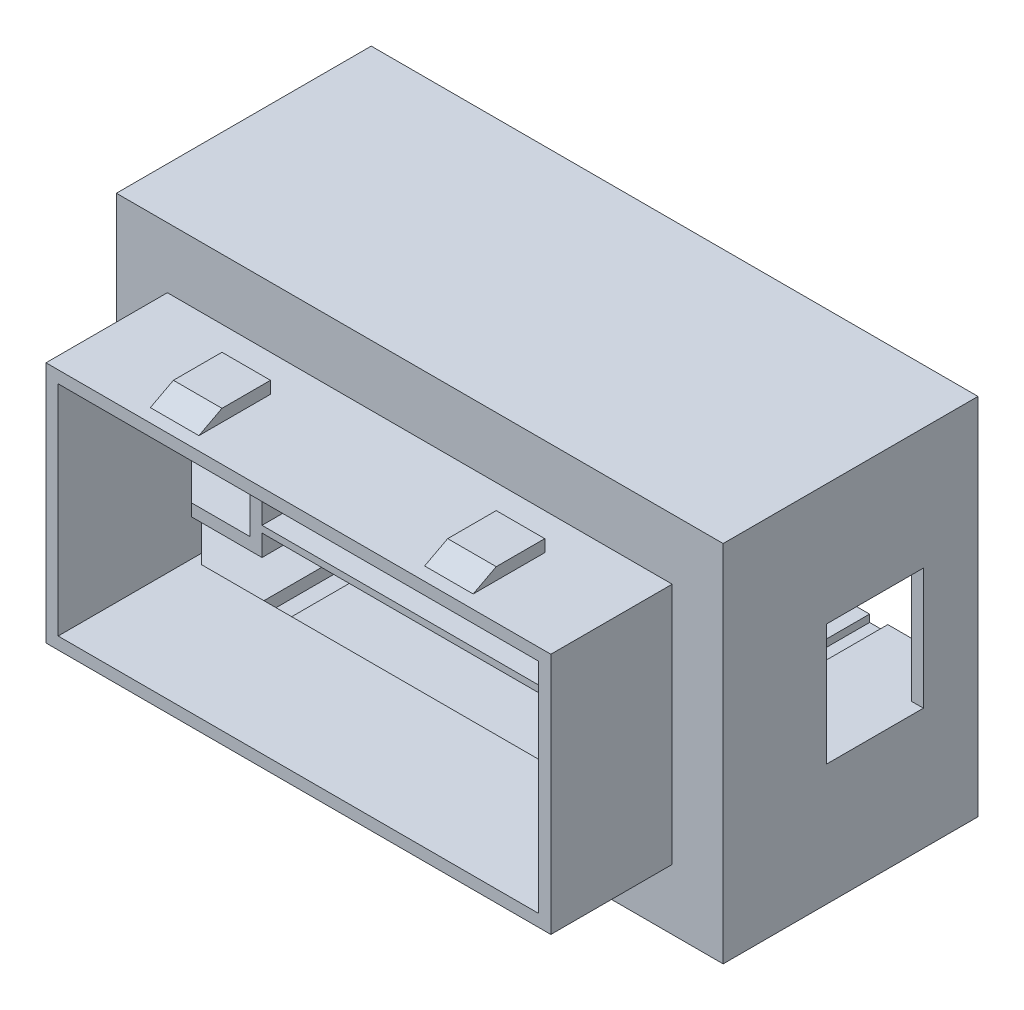
from build123d import *

# Parameters (mm, degrees)
SKETCH1_W            = 41.6
SKETCH1_H            = 20
SKETCH1_W_2          = 39.6
SKETCH1_H_2          = 18
BOSS_EXTRUDE2_DEPTH  = 10
SKETCH2_W            = 4
SKETCH2_H            = 10
BOSS_EXTRUDE3_DEPTH  = 1
SKETCH3_W            = 3
SKETCH3_H            = 1
CUT_EXTRUDE1_DEPTH   = 27
SKETCH4_W            = 4
SKETCH4_H            = 10
BOSS_EXTRUDE4_DEPTH  = 1
SKETCH5_W            = 3
SKETCH5_H            = 1
CUT_EXTRUDE2_DEPTH   = 27
SKETCH6_W            = 50
SKETCH6_H            = 30
SKETCH6_W_2          = 41.6
SKETCH6_H_2          = 20
SKETCH6_W_3          = 39.6
SKETCH6_H_3          = 18
BOSS_EXTRUDE6_DEPTH  = 1
SKETCH7_W            = 50
SKETCH7_H            = 30
SKETCH7_W_2          = 48
SKETCH7_H_2          = 28
BOSS_EXTRUDE7_DEPTH  = 20
SKETCH8_W            = 4.2
SKETCH8_H            = 1
BOSS_EXTRUDE8_DEPTH  = 20
SKETCH9_W            = 4.2
SKETCH9_H            = 1
BOSS_EXTRUDE9_DEPTH  = 20
SKETCH10_W           = 4
SKETCH10_H           = 4
BOSS_EXTRUDE10_DEPTH = 20
SKETCH11_W           = 2
SKETCH11_H           = 10
CUT_EXTRUDE3_DEPTH   = 1
SKETCH12_W           = 2
SKETCH12_H           = 10
CUT_EXTRUDE4_DEPTH   = 1
SKETCH13_R           = 1.5
CUT_EXTRUDE5_DEPTH   = 10
CHAMFER2_SIZE        = 5
CHAMFER3_SIZE        = 5
CHAMFER4_SIZE        = 4
SKETCH16_W           = 1.2
SKETCH16_H           = 1
BOSS_EXTRUDE11_DEPTH = 20
BOSS_EXTRUDE12_DEPTH = 20
SKETCH18_W           = 28
SKETCH18_H           = 0.549749779
BOSS_EXTRUDE13_DEPTH = 20
SKETCH19_W           = 1.2
SKETCH19_H           = 1
CUT_EXTRUDE6_DEPTH   = 20
SKETCH20_W           = 1.5
SKETCH20_H           = 1
BOSS_EXTRUDE14_DEPTH = 20
SKETCH22_W           = 0.3
SKETCH22_H           = 1
BOSS_EXTRUDE16_DEPTH = 20
SKETCH24_W           = 1.2
SKETCH24_H           = 1
CUT_EXTRUDE7_DEPTH   = 20
SKETCH25_W           = 1.5
SKETCH25_H           = 1
BOSS_EXTRUDE17_DEPTH = 20
SKETCH26_W           = 1.5
SKETCH26_H           = 0.6
CUT_EXTRUDE8_DEPTH   = 20
SKETCH27_W           = 1.5
SKETCH27_H           = 0.6
CUT_EXTRUDE9_DEPTH   = 20


# Some blends are built 0.0001 mm under size
with BuildPart() as part:
    # Sketch1 → Boss-Extrude2 (new body)
    with BuildSketch(Plane.XY):
        Rectangle(SKETCH1_W, SKETCH1_H)
        Rectangle(SKETCH1_W_2, SKETCH1_H_2, mode=Mode.SUBTRACT)
    extrude(amount=BOSS_EXTRUDE2_DEPTH)

    # Sketch2 → Boss-Extrude3 (add)
    with BuildSketch(Plane.XZ.offset(10)):
        with Locations((-11.3, 5)):
            Rectangle(SKETCH2_W, SKETCH2_H)
        with Locations((11.3, 5)):
            Rectangle(SKETCH2_W, SKETCH2_H)
    extrude(amount=BOSS_EXTRUDE3_DEPTH)

    # Sketch3 → Cut-Extrude1 (cut)
    with BuildSketch(Plane.ZY.offset(13.3)):
        Polygon((8.900149248, -10), (7, -11), (10, -11), (10, -10), align=None)
        with Locations((1.5, -10.5)):
            Rectangle(SKETCH3_W, SKETCH3_H)
    extrude(amount=-CUT_EXTRUDE1_DEPTH, mode=Mode.SUBTRACT)

    # Sketch4 → Boss-Extrude4 (add)
    with BuildSketch(Plane(origin=(0, 10, 0), x_dir=(1, 0, 0), z_dir=(0, 1, 0))):
        with Locations((11.3, -5)):
            Rectangle(SKETCH4_W, SKETCH4_H)
        with Locations((-11.3, -5)):
            Rectangle(SKETCH4_W, SKETCH4_H)
    extrude(amount=BOSS_EXTRUDE4_DEPTH)

    # Sketch5 → Cut-Extrude2 (cut)
    with BuildSketch(Plane(origin=(13.3, 0, 0), x_dir=(0, 0, -1), z_dir=(1, 0, 0))):
        Polygon((-7, 11), (-10, 11), (-10, 10), (-8.900149248, 10), align=None)
        with Locations((-1.5, 10.5)):
            Rectangle(SKETCH5_W, SKETCH5_H)
    extrude(amount=-CUT_EXTRUDE2_DEPTH, mode=Mode.SUBTRACT)

    # Sketch6 → Boss-Extrude6 (add)
    # profile 1 of 2: a face of its own
    with BuildSketch(Plane(origin=(0, 0, 0), x_dir=(-1, 0, 0), z_dir=(0, 0, -1))):
        Rectangle(SKETCH6_W, SKETCH6_H)
        Rectangle(SKETCH6_W_2, SKETCH6_H_2, mode=Mode.SUBTRACT)
    # profile 2 of 2: a face of its own
    with BuildSketch(Plane(origin=(0, 0, 0), x_dir=(-1, 0, 0), z_dir=(0, 0, -1))):
        Rectangle(SKETCH6_W_2, SKETCH6_H_2)
        Rectangle(SKETCH6_W_3, SKETCH6_H_3, mode=Mode.SUBTRACT)
    extrude(amount=BOSS_EXTRUDE6_DEPTH)

    # Sketch7 → Boss-Extrude7 (add)
    with BuildSketch(Plane(origin=(0, 0, -1), x_dir=(-1, 0, 0), z_dir=(0, 0, -1))):
        Rectangle(SKETCH7_W, SKETCH7_H)
        Rectangle(SKETCH7_W_2, SKETCH7_H_2, mode=Mode.SUBTRACT)
    extrude(amount=BOSS_EXTRUDE7_DEPTH)

    # Sketch8 → Boss-Extrude8 (add)
    with BuildSketch(Plane(origin=(0, 0, -1), x_dir=(-1, 0, 0), z_dir=(0, 0, -1))):
        Polygon((-15, -5), (-19.8, -5), (-19.8, -6), (-14, -6), (-14, 6), (-19.8, 6), (-19.8, 5), (-15, 5), align=None)
        with Locations((-21.9, 5.5)):
            Rectangle(SKETCH8_W, SKETCH8_H)
        with Locations((-21.9, -5.5)):
            Rectangle(SKETCH8_W, SKETCH8_H)
    extrude(amount=BOSS_EXTRUDE8_DEPTH)

    # Sketch9 → Boss-Extrude9 (add)
    with BuildSketch(Plane(origin=(0, 0, -1), x_dir=(-1, 0, 0), z_dir=(0, 0, -1))):
        Polygon((15, 5), (19.8, 5), (19.8, 6), (14, 6), (14, -6), (19.8, -6), (19.8, -5), (15, -5), align=None)
        with Locations((21.9, 5.5)):
            Rectangle(SKETCH9_W, SKETCH9_H)
        with Locations((21.9, -5.5)):
            Rectangle(SKETCH9_W, SKETCH9_H)
    extrude(amount=BOSS_EXTRUDE9_DEPTH)

    # Sketch10 → Boss-Extrude10 (add)
    with BuildSketch(Plane(origin=(0, 0, -1), x_dir=(-1, 0, 0), z_dir=(0, 0, -1))):
        with Locations((-22, 12)):
            Rectangle(SKETCH10_W, SKETCH10_H)
        with Locations((22, 12)):
            Rectangle(SKETCH10_W, SKETCH10_H)
        with Locations((22, -12)):
            Rectangle(SKETCH10_W, SKETCH10_H)
        with Locations((-22, -12)):
            Rectangle(SKETCH10_W, SKETCH10_H)
    extrude(amount=BOSS_EXTRUDE10_DEPTH)

    # Sketch11 → Cut-Extrude3 (cut)
    with BuildSketch(Plane.ZY.offset(25)):
        Polygon((-10.5, -5), (-10.5, 5), (-16.5, 5), (-16.5, 0), (-16.5, -5), align=None)
        with Locations((-9.5, 0)):
            Rectangle(SKETCH11_W, SKETCH11_H)
    extrude(amount=-CUT_EXTRUDE3_DEPTH, mode=Mode.SUBTRACT)

    # Sketch12 → Cut-Extrude4 (cut)
    with BuildSketch(Plane(origin=(25, 0, 0), x_dir=(0, 0, -1), z_dir=(1, 0, 0))):
        with Locations((9.5, 0)):
            Rectangle(SKETCH12_W, SKETCH12_H)
        Polygon((16.5, 5), (10.5, 5), (10.5, -5), (16.5, -5), (16.5, 0), align=None)
    extrude(amount=-CUT_EXTRUDE4_DEPTH, mode=Mode.SUBTRACT)

    # Sketch13 → Cut-Extrude5 (cut)
    with BuildSketch(Plane(origin=(0, 0, -21), x_dir=(-1, 0, 0), z_dir=(0, 0, -1))):
        with Locations((-22.5, 12.5)):
            Circle(SKETCH13_R)
        with Locations((22.5, 12.5)):
            Circle(SKETCH13_R)
        with Locations((22.5, -12.5)):
            Circle(SKETCH13_R)
        with Locations((-22.5, -12.5)):
            Circle(SKETCH13_R)
    extrude(amount=-CUT_EXTRUDE5_DEPTH, mode=Mode.SUBTRACT)

    # Chamfer2
    chamfer2_edges = [part.edges().sort_by_distance(p)[0] for p in [
        (0, 14, -1),
        (0, -14, -1),
    ]]
    chamfer(chamfer2_edges, length=CHAMFER2_SIZE - 0.0001)  # a hair under: the kernel refuses the full size

    # Chamfer3
    # the kernel refuses this chamfer: 5 mm, written as the material it adds along each edge
    with BuildSketch(Plane(origin=(24, -21.85851494, -1), x_dir=(-0.9996219169112968, 0, 0.02749587661058636), z_dir=(0, 1, 0))) as chamfer3_piece_1_section:
        Polygon((CHAMFER3_SIZE * 0.999621916911, -CHAMFER3_SIZE * 0.0274958766106), (-CHAMFER3_SIZE * 0.0274958766106, -CHAMFER3_SIZE * 0.999621916911), (0, 0), align=None)
    chamfer3_piece_1 = extrude(amount=28.71692988, mode=Mode.PRIVATE)
    chamfer3_piece_1 = split(chamfer3_piece_1, bisect_by=Plane(origin=(19.8, -10.000025, -1.99995), z_dir=(1, 0, 0)), keep=Keep.TOP, mode=Mode.PRIVATE)
    chamfer3_piece_1 = split(chamfer3_piece_1, bisect_by=Plane(origin=(19.999975, -5, -1.99995), z_dir=(0, -1, 0)), keep=Keep.TOP, mode=Mode.PRIVATE)
    chamfer3_piece_1 = split(chamfer3_piece_1, bisect_by=Plane(origin=(19.999975, -10.0000375, -1.9999375), z_dir=(0, 0.7071067811865476, -0.7071067811865476)), keep=Keep.TOP, mode=Mode.PRIVATE)
    add(chamfer3_piece_1)
    with BuildSketch(Plane(origin=(24, -21.85851494, -1), x_dir=(-0.9996219169112968, 0, 0.02749587661058636), z_dir=(0, 1, 0))) as chamfer3_piece_2_section:
        Polygon((CHAMFER3_SIZE * 0.999621916911, -CHAMFER3_SIZE * 0.0274958766106), (-CHAMFER3_SIZE * 0.0274958766106, -CHAMFER3_SIZE * 0.999621916911), (0, 0), align=None)
    chamfer3_piece_2 = extrude(amount=28.71692988, mode=Mode.PRIVATE)
    chamfer3_piece_2 = split(chamfer3_piece_2, bisect_by=Plane(origin=(19.599975009, -9, -1.399950019), z_dir=(0, -1, 0)), keep=Keep.TOP, mode=Mode.PRIVATE)
    chamfer3_piece_2 = split(chamfer3_piece_2, bisect_by=Plane(origin=(19.599975009, -9.300037514, -1.299937514), z_dir=(0, 0.7071067811865476, -0.7071067811865476)), keep=Keep.TOP, mode=Mode.PRIVATE)
    add(chamfer3_piece_2)
    with BuildSketch(Plane(origin=(24, -21.85851494, -1), x_dir=(-0.9996219169112968, 0, 0.02749587661058636), z_dir=(0, 1, 0))) as chamfer3_piece_3_section:
        Polygon((CHAMFER3_SIZE * 0.999621916911, -CHAMFER3_SIZE * 0.0274958766106), (-CHAMFER3_SIZE * 0.0274958766106, -CHAMFER3_SIZE * 0.999621916911), (0, 0), align=None)
    chamfer3_piece_3 = extrude(amount=28.71692988, mode=Mode.PRIVATE)
    chamfer3_piece_3 = split(chamfer3_piece_3, bisect_by=Plane(origin=(19.8, 6.42920747, -1.451851852), z_dir=(1, 0, 0)), keep=Keep.TOP, mode=Mode.PRIVATE)
    chamfer3_piece_3 = split(chamfer3_piece_3, bisect_by=Plane(origin=(19.903703704, 5, -1.451851852), z_dir=(0, 1, 0)), keep=Keep.TOP, mode=Mode.PRIVATE)
    add(chamfer3_piece_3)
    with BuildSketch(Plane(origin=(-24, 21.85851494, -1), x_dir=(0.9996219169112968, 0, 0.02749587661058636), z_dir=(0, -1, 0))) as chamfer3_piece_4_section:
        Polygon((CHAMFER3_SIZE * 0.999621916911, -CHAMFER3_SIZE * 0.0274958766106), (-CHAMFER3_SIZE * 0.0274958766106, -CHAMFER3_SIZE * 0.999621916911), (0, 0), align=None)
    chamfer3_piece_4 = extrude(amount=28.71692988, mode=Mode.PRIVATE)
    chamfer3_piece_4 = split(chamfer3_piece_4, bisect_by=Plane(origin=(-19.8, 10.000025, -1.99995), z_dir=(-1, 0, 0)), keep=Keep.TOP, mode=Mode.PRIVATE)
    chamfer3_piece_4 = split(chamfer3_piece_4, bisect_by=Plane(origin=(-19.999975, 15, -1.99995), z_dir=(0, -1, 0)), keep=Keep.TOP, mode=Mode.PRIVATE)
    chamfer3_piece_4 = split(chamfer3_piece_4, bisect_by=Plane(origin=(-19.999975, 5, -1.99995), z_dir=(0, 1, 0)), keep=Keep.TOP, mode=Mode.PRIVATE)
    add(chamfer3_piece_4)
    with BuildSketch(Plane(origin=(-24, 21.85851494, -1), x_dir=(0.9996219169112968, 0, 0.02749587661058636), z_dir=(0, -1, 0))) as chamfer3_piece_5_section:
        Polygon((CHAMFER3_SIZE * 0.999621916911, -CHAMFER3_SIZE * 0.0274958766106), (-CHAMFER3_SIZE * 0.0274958766106, -CHAMFER3_SIZE * 0.999621916911), (0, 0), align=None)
    chamfer3_piece_5 = extrude(amount=28.71692988, mode=Mode.PRIVATE)
    chamfer3_piece_5 = split(chamfer3_piece_5, bisect_by=Plane(origin=(-19.599975009, 9, -1.399950019), z_dir=(0, 1, 0)), keep=Keep.TOP, mode=Mode.PRIVATE)
    chamfer3_piece_5 = split(chamfer3_piece_5, bisect_by=Plane(origin=(-19.599975009, 15, -1.399950019), z_dir=(0, -1, 0)), keep=Keep.TOP, mode=Mode.PRIVATE)
    add(chamfer3_piece_5)
    with BuildSketch(Plane(origin=(-24, 21.85851494, -1), x_dir=(0.9996219169112968, 0, 0.02749587661058636), z_dir=(0, -1, 0))) as chamfer3_piece_6_section:
        Polygon((CHAMFER3_SIZE * 0.999621916911, -CHAMFER3_SIZE * 0.0274958766106), (-CHAMFER3_SIZE * 0.0274958766106, -CHAMFER3_SIZE * 0.999621916911), (0, 0), align=None)
    chamfer3_piece_6 = extrude(amount=28.71692988, mode=Mode.PRIVATE)
    chamfer3_piece_6 = split(chamfer3_piece_6, bisect_by=Plane(origin=(-19.8, -6.42920747, -1.451851852), z_dir=(-1, 0, 0)), keep=Keep.TOP, mode=Mode.PRIVATE)
    chamfer3_piece_6 = split(chamfer3_piece_6, bisect_by=Plane(origin=(-19.903703704, -6, -1.451851852), z_dir=(0, -1, 0)), keep=Keep.TOP, mode=Mode.PRIVATE)
    add(chamfer3_piece_6)
    with BuildSketch(Plane(origin=(-24, 6.85841494, -1), x_dir=(0.9996219169112968, 0, 0.02749587661058636), z_dir=(0, -1, 0))) as chamfer3_piece_7_section:
        Polygon((CHAMFER3_SIZE * 0.999621916911, -CHAMFER3_SIZE * 0.0274958766106), (-CHAMFER3_SIZE * 0.0274958766106, -CHAMFER3_SIZE * 0.999621916911), (0, 0), align=None)
    chamfer3_piece_7 = extrude(amount=28.71692988, mode=Mode.PRIVATE)
    chamfer3_piece_7 = split(chamfer3_piece_7, bisect_by=Plane(origin=(-19.8, 6.42920747, -1.451851852), z_dir=(-1, 0, 0)), keep=Keep.TOP, mode=Mode.PRIVATE)
    chamfer3_piece_7 = split(chamfer3_piece_7, bisect_by=Plane(origin=(-19.903703704, 5, -1.451851852), z_dir=(0, 1, 0)), keep=Keep.TOP, mode=Mode.PRIVATE)
    add(chamfer3_piece_7)
    with BuildSketch(Plane(origin=(-24, -6, -1), x_dir=(0.9996219169112968, 0, 0.02749587661058636), z_dir=(0, -1, 0))) as chamfer3_piece_8_section:
        Polygon((CHAMFER3_SIZE * 0.999621916911, -CHAMFER3_SIZE * 0.0274958766106), (-CHAMFER3_SIZE * 0.0274958766106, -CHAMFER3_SIZE * 0.999621916911), (0, 0), align=None)
    chamfer3_piece_8 = extrude(amount=15.85851494, mode=Mode.PRIVATE)
    chamfer3_piece_8 = split(chamfer3_piece_8, bisect_by=Plane(origin=(-19.8, -7.5, -1.451851852), z_dir=(-1, 0, 0)), keep=Keep.TOP, mode=Mode.PRIVATE)
    chamfer3_piece_8 = split(chamfer3_piece_8, bisect_by=Plane(origin=(-19.903703704, -8.475975926, -0.475875926), z_dir=(0, 0.7071067811865476, -0.7071067811865476)), keep=Keep.TOP, mode=Mode.PRIVATE)
    add(chamfer3_piece_8)
    with BuildSketch(Plane(origin=(-24, 6.85841494, -1), x_dir=(0.9996219169112968, 0, 0.02749587661058636), z_dir=(0, -1, 0))) as chamfer3_piece_9_section:
        Polygon((CHAMFER3_SIZE * 0.999621916911, -CHAMFER3_SIZE * 0.0274958766106), (-CHAMFER3_SIZE * 0.0274958766106, -CHAMFER3_SIZE * 0.999621916911), (0, 0), align=None)
    chamfer3_piece_9 = extrude(amount=28.71692988, mode=Mode.PRIVATE)
    chamfer3_piece_9 = split(chamfer3_piece_9, bisect_by=Plane(origin=(-19.599975009, -9, -1.399950019), z_dir=(0, -1, 0)), keep=Keep.TOP, mode=Mode.PRIVATE)
    chamfer3_piece_9 = split(chamfer3_piece_9, bisect_by=Plane(origin=(-19.599975009, -9.300037514, -1.299937514), z_dir=(0, 0.7071067811865476, -0.7071067811865476)), keep=Keep.TOP, mode=Mode.PRIVATE)
    add(chamfer3_piece_9)
    with BuildSketch(Plane(origin=(24, -6.85841494, -1), x_dir=(-0.9996219169112968, 0, 0.02749587661058636), z_dir=(0, 1, 0))) as chamfer3_piece_10_section:
        Polygon((CHAMFER3_SIZE * 0.999621916911, -CHAMFER3_SIZE * 0.0274958766106), (-CHAMFER3_SIZE * 0.0274958766106, -CHAMFER3_SIZE * 0.999621916911), (0, 0), align=None)
    chamfer3_piece_10 = extrude(amount=28.71692988, mode=Mode.PRIVATE)
    chamfer3_piece_10 = split(chamfer3_piece_10, bisect_by=Plane(origin=(19.8, -6.42920747, -1.451851852), z_dir=(1, 0, 0)), keep=Keep.TOP, mode=Mode.PRIVATE)
    chamfer3_piece_10 = split(chamfer3_piece_10, bisect_by=Plane(origin=(19.903703704, -5, -1.451851852), z_dir=(0, -1, 0)), keep=Keep.TOP, mode=Mode.PRIVATE)
    add(chamfer3_piece_10)
    with BuildSketch(Plane(origin=(24, -6.85841494, -1), x_dir=(-0.9996219169112968, 0, 0.02749587661058636), z_dir=(0, 1, 0))) as chamfer3_piece_11_section:
        Polygon((CHAMFER3_SIZE * 0.999621916911, -CHAMFER3_SIZE * 0.0274958766106), (-CHAMFER3_SIZE * 0.0274958766106, -CHAMFER3_SIZE * 0.999621916911), (0, 0), align=None)
    chamfer3_piece_11 = extrude(amount=28.71692988, mode=Mode.PRIVATE)
    chamfer3_piece_11 = split(chamfer3_piece_11, bisect_by=Plane(origin=(19.8, 7.5, -1.451851852), z_dir=(1, 0, 0)), keep=Keep.TOP, mode=Mode.PRIVATE)
    chamfer3_piece_11 = split(chamfer3_piece_11, bisect_by=Plane(origin=(19.903703704, 15, -1.451851852), z_dir=(0, -1, 0)), keep=Keep.TOP, mode=Mode.PRIVATE)
    chamfer3_piece_11 = split(chamfer3_piece_11, bisect_by=Plane(origin=(19.903703704, 5, -1.451851852), z_dir=(0, 1, 0)), keep=Keep.TOP, mode=Mode.PRIVATE)
    add(chamfer3_piece_11)
    with BuildSketch(Plane(origin=(24, -6.85841494, -1), x_dir=(-0.9996219169112968, 0, 0.02749587661058636), z_dir=(0, 1, 0))) as chamfer3_piece_12_section:
        Polygon((CHAMFER3_SIZE * 0.999621916911, -CHAMFER3_SIZE * 0.0274958766106), (-CHAMFER3_SIZE * 0.0274958766106, -CHAMFER3_SIZE * 0.999621916911), (0, 0), align=None)
    chamfer3_piece_12 = extrude(amount=28.71692988, mode=Mode.PRIVATE)
    chamfer3_piece_12 = split(chamfer3_piece_12, bisect_by=Plane(origin=(19.599975009, 9, -1.399950019), z_dir=(0, 1, 0)), keep=Keep.TOP, mode=Mode.PRIVATE)
    chamfer3_piece_12 = split(chamfer3_piece_12, bisect_by=Plane(origin=(19.599975009, 15, -1.399950019), z_dir=(0, -1, 0)), keep=Keep.TOP, mode=Mode.PRIVATE)
    add(chamfer3_piece_12)

    # Chamfer4
    chamfer4_edges = [part.edges().sort_by_distance(p)[0] for p in [
        (24, 0, -1),
        (-24, 0, -1),
    ]]
    chamfer(chamfer4_edges, length=CHAMFER4_SIZE)

    # Sketch16 → Boss-Extrude11 (add)
    with BuildSketch(Plane(origin=(0, 0, -21), x_dir=(-1, 0, 0), z_dir=(0, 0, -1))):
        with Locations((-13.4, 0.5)):
            Rectangle(SKETCH16_W, SKETCH16_H)
        with Locations((-13.4, -1.5)):
            Rectangle(SKETCH16_W, SKETCH16_H)
        with Locations((13.4, 0.5)):
            Rectangle(SKETCH16_W, SKETCH16_H)
        Polygon((13, -1), (12.8, -1), (12.8, -2), (14, -2), (14, -1), align=None)
    extrude(amount=-BOSS_EXTRUDE11_DEPTH)

    # Sketch17 → Boss-Extrude12 (add)
    with BuildSketch(Plane(origin=(0, 0, -21), x_dir=(-1, 0, 0), z_dir=(0, 0, -1))):
        Polygon((-20, -10), (-20, -10.5), (-16.744161901, -10.5), (12.056353702, -10.5), (12.056353702, -9.5), (-24, -9.5), (-24, -10), align=None)
        Polygon((14.342415664, -9.5), (14.342415664, -10.5), (20, -10.5), (20, -10), (24, -10), (24, -9.5), align=None)
    extrude(amount=-BOSS_EXTRUDE12_DEPTH)

    # Sketch18 → Boss-Extrude13 (add)
    with BuildSketch(Plane(origin=(0, 0, -21), x_dir=(-1, 0, 0), z_dir=(0, 0, -1))):
        with Locations((0, -3.97487489)):
            Rectangle(SKETCH18_W, SKETCH18_H)
    extrude(amount=-BOSS_EXTRUDE13_DEPTH)

    # Sketch19 → Cut-Extrude6 (cut)
    with BuildSketch(Plane(origin=(0, 0, -21), x_dir=(-1, 0, 0), z_dir=(0, 0, -1))):
        with Locations((-13.4, 0.5)):
            Rectangle(SKETCH19_W, SKETCH19_H)
    extrude(amount=-CUT_EXTRUDE6_DEPTH, mode=Mode.SUBTRACT)

    # Sketch20 → Boss-Extrude14 (add)
    with BuildSketch(Plane(origin=(0, 0, -21), x_dir=(-1, 0, 0), z_dir=(0, 0, -1))):
        with Locations((-13.25, 1.2)):
            Rectangle(SKETCH20_W, SKETCH20_H)
    extrude(amount=-BOSS_EXTRUDE14_DEPTH)

    # Sketch22 → Boss-Extrude16 (add)
    with BuildSketch(Plane(origin=(0, 0, -21), x_dir=(-1, 0, 0), z_dir=(0, 0, -1))):
        with Locations((-12.65, -1.5)):
            Rectangle(SKETCH22_W, SKETCH22_H)
    extrude(amount=-BOSS_EXTRUDE16_DEPTH)

    # Sketch24 → Cut-Extrude7 (cut)
    with BuildSketch(Plane(origin=(0, 0, -21), x_dir=(-1, 0, 0), z_dir=(0, 0, -1))):
        with Locations((13.4, 0.5)):
            Rectangle(SKETCH24_W, SKETCH24_H)
    extrude(amount=-CUT_EXTRUDE7_DEPTH, mode=Mode.SUBTRACT)

    # Sketch25 → Boss-Extrude17 (add)
    with BuildSketch(Plane(origin=(0, 0, -21), x_dir=(-1, 0, 0), z_dir=(0, 0, -1))):
        with Locations((13.25, 1.2)):
            Rectangle(SKETCH25_W, SKETCH25_H)
    extrude(amount=-BOSS_EXTRUDE17_DEPTH)

    # Sketch26 → Cut-Extrude8 (cut)
    with BuildSketch(Plane(origin=(0, 0, -21), x_dir=(-1, 0, 0), z_dir=(0, 0, -1))):
        with Locations((16.75, 5.3)):
            Rectangle(SKETCH26_W, SKETCH26_H)
    extrude(amount=-CUT_EXTRUDE8_DEPTH, mode=Mode.SUBTRACT)

    # Sketch27 → Cut-Extrude9 (cut)
    with BuildSketch(Plane(origin=(0, 0, -21), x_dir=(-1, 0, 0), z_dir=(0, 0, -1))):
        with Locations((-16.817086242, -5.3)):
            Rectangle(SKETCH27_W, SKETCH27_H)
    extrude(amount=-CUT_EXTRUDE9_DEPTH, mode=Mode.SUBTRACT)


solid = part.part
